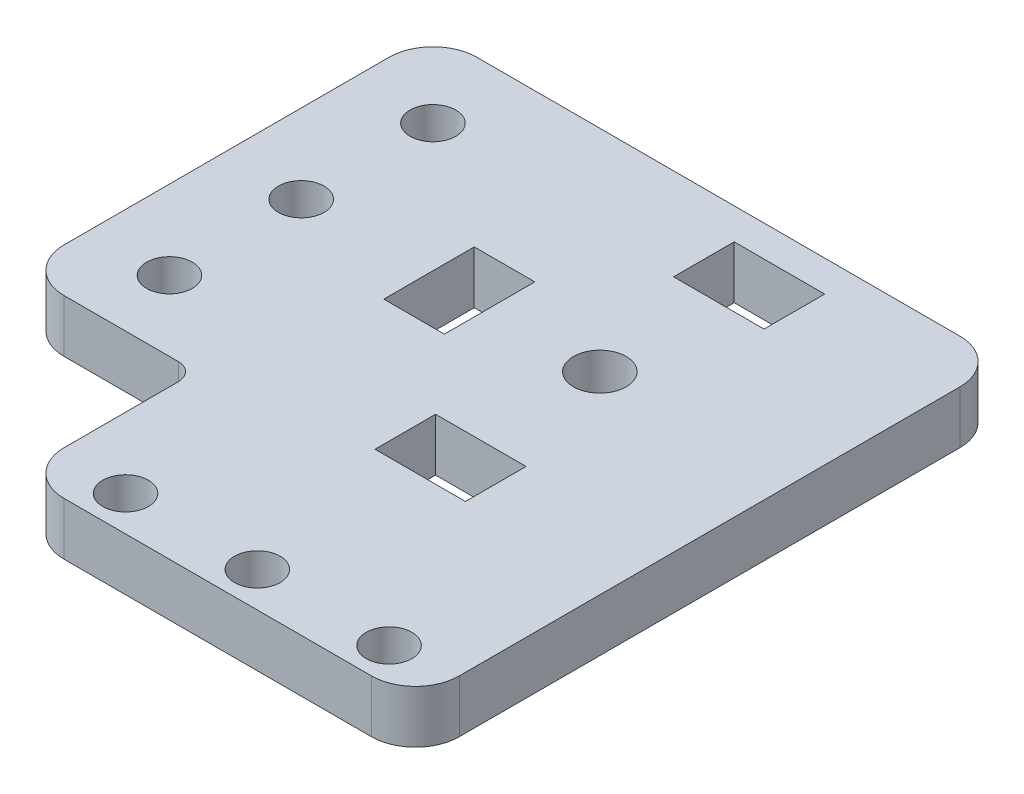
from build123d import *

# Parameters (mm, degrees)
SKETCH2_R          = 2.6
BASE_FLANGE1_DEPTH = 6
FILLET1_R          = 5
FILLET2_R          = 2
SKETCH6_R          = 3
SKETCH6_W          = 6.9
SKETCH6_H          = 10.3
SKETCH6_W_2        = 10.3
SKETCH6_H_2        = 6.9
CUT_EXTRUDE3_DEPTH = 10


# Sheet-metal steps are written as plain solids
with BuildPart() as part:
    # Sketch2 → Base-Flange1 (new body)
    with BuildSketch(Plane(origin=(0, 0, 0), x_dir=(1, 0, 0), z_dir=(0, 1, 0))):
        Polygon((0, 72), (65, 72), (65, 5), (20, 5), (20, 25), (0, 25), align=None)
        with Locations(Location((28, 9, 0), (0, 0, 270))):
            Circle(SKETCH2_R, mode=Mode.SUBTRACT)
        with Locations(Location((43, 9, 0), (0, 0, 270))):
            Circle(SKETCH2_R, mode=Mode.SUBTRACT)
        with Locations(Location((58, 9, 0), (0, 0, 270))):
            Circle(SKETCH2_R, mode=Mode.SUBTRACT)
        with Locations(Location((9, 33, 0), (0, 0, 270))):
            Circle(SKETCH2_R, mode=Mode.SUBTRACT)
        with Locations(Location((9, 48, 0), (0, 0, 270))):
            Circle(SKETCH2_R, mode=Mode.SUBTRACT)
        with Locations(Location((9, 63, 0), (0, 0, 270))):
            Circle(SKETCH2_R, mode=Mode.SUBTRACT)
    extrude(amount=-BASE_FLANGE1_DEPTH)

    # Fillet1
    fillet1_edges = [part.edges().sort_by_distance(p)[0] for p in [
        (0, -3, -25),
        (0, -3, -72),
        (65, -3, -72),
        (65, -3, -5),
        (20, -3, -5),
    ]]
    fillet(fillet1_edges, radius=FILLET1_R)

    # Fillet2
    fillet2_edges = [part.edges().sort_by_distance(p)[0] for p in [
        (20, -3, -25),
    ]]
    fillet(fillet2_edges, radius=FILLET2_R)

    # Sketch6 → Cut-Extrude3 (cut)
    with BuildSketch(Plane(origin=(0, 0, 0), x_dir=(1, 0, 0), z_dir=(0, 1, 0))):
        with Locations(Location((43, 48, 0), (0, 0, 270))):
            Circle(SKETCH6_R)
        with Locations((27, 48)):
            Rectangle(SKETCH6_W, SKETCH6_H)
        with Locations((43, 31)):
            Rectangle(SKETCH6_W_2, SKETCH6_H_2)
        with Locations((43, 65)):
            Rectangle(SKETCH6_W_2, SKETCH6_H_2)
    extrude(amount=-CUT_EXTRUDE3_DEPTH, mode=Mode.SUBTRACT)


solid = part.part
